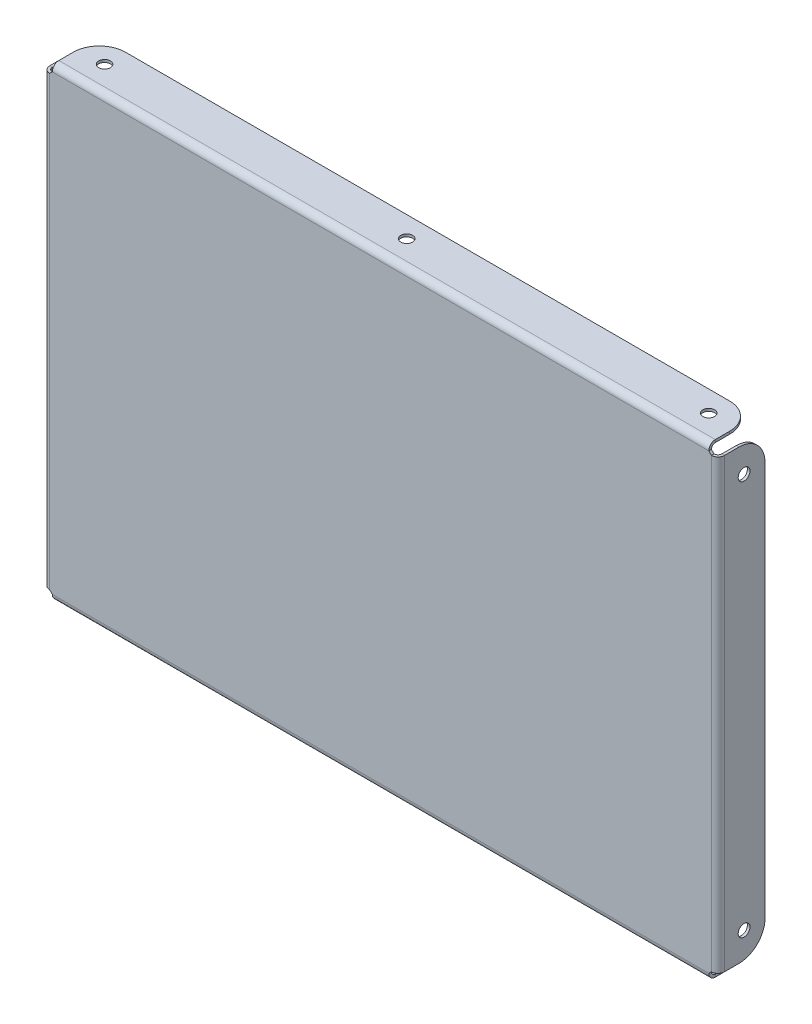
from build123d import *

# Parameters (mm, degrees)
MAIN_PLATE_DEPTH                         = 1
LONG_EDGE_DEPTH                          = 251
LONG_EDGE_FILLETS_R                      = 10
M4_CLEARANCE_HOLE1_D                     = 4.5
M4_CLEARANCE_HOLE1_DEPTH                 = 178
SHORT_EDGE_DEPTH                         = 171
SHORT_EDGE_FILLETS_R                     = 10
M4_CLEARANCE_HOLE2_D                     = 4.5
M4_CLEARANCE_HOLE2_DEPTH                 = 258
LONG_EDGE_FILLETS_OF_OTHER_LONG_EDGE_R   = 10
SHORT_EDGE_FILLETS_OF_OTHER_SHORT_EDGE_R = 10


# Sheet-metal steps are written as plain solids
with BuildPart() as part:
    # Sketch1 → Main Plate (new body)
    with BuildSketch(Plane.XY):
        Polygon((-126.5, -85.5), (-125.5, -86.5), (125.5, -86.5), (126.5, -85.5), (126.5, 85.5), (125.5, 86.5), (-125.5, 86.5), (-126.5, 85.5), align=None)
    extrude(amount=-MAIN_PLATE_DEPTH)

    # Long Edge section (across the edge) → Long Edge (add)
    with BuildSketch(Plane(origin=(-125.5, 88, -1), x_dir=(0, -1, 0), z_dir=(1, 0, 0))):
        with BuildLine():
            Line((-1, 1.5), (-1, 17))
            Line((-1, 17), (0, 17))
            Line((0, 17), (0, 1.5))
            ThreePointArc((0, 1.5), (0.439339828, 0.439339828), (1.5, 0))
            Line((1.5, 0), (1.5, -1))
            ThreePointArc((1.5, -1), (-0.267766953, -0.267766953), (-1, 1.5))
        make_face()
    long_edge = extrude(amount=LONG_EDGE_DEPTH)

    # Long Edge Fillets
    long_edge_fillets_edges = [part.edges().sort_by_distance(p)[0] for p in [
        (-125.5, 88.5, -18),
        (125.5, 88.5, -18),
    ]]
    fillet(long_edge_fillets_edges, radius=LONG_EDGE_FILLETS_R)

    # M4 Clearance Hole1
    with Locations(Plane(origin=(0, 89, 0), x_dir=(1, 0, 0), z_dir=(0, 1, 0))):
        with Locations((-115.5, 10), (115.5, 10), (0, 10)):
            m4_clearance_hole1 = Hole(M4_CLEARANCE_HOLE1_D / 2, depth=M4_CLEARANCE_HOLE1_DEPTH)

    # Short Edge section (across the edge) → Short Edge (add)
    with BuildSketch(Plane(origin=(128, 85.5, -1), x_dir=(-1, 0, 0), z_dir=(0, -1, 0))):
        with BuildLine():
            Line((-1, 1.5), (-1, 17))
            Line((-1, 17), (0, 17))
            Line((0, 17), (0, 1.5))
            ThreePointArc((0, 1.5), (0.439339828, 0.439339828), (1.5, 0))
            Line((1.5, 0), (1.5, -1))
            ThreePointArc((1.5, -1), (-0.267766953, -0.267766953), (-1, 1.5))
        make_face()
    short_edge = extrude(amount=SHORT_EDGE_DEPTH)

    # Short Edge Fillets
    short_edge_fillets_edges = [part.edges().sort_by_distance(p)[0] for p in [
        (128.5, 85.5, -18),
        (128.5, -85.5, -18),
    ]]
    fillet(short_edge_fillets_edges, radius=SHORT_EDGE_FILLETS_R)

    # M4 Clearance Hole2
    with Locations(Plane(origin=(129, 0, 0), x_dir=(0, 0, -1), z_dir=(1, 0, 0))):
        with Locations((10, -75.5), (10, 75.5)):
            m4_clearance_hole2 = Hole(M4_CLEARANCE_HOLE2_D / 2, depth=M4_CLEARANCE_HOLE2_DEPTH)

    # Other Long Edge: Long Edge, M4 Clearance Hole1 across plane
    add(long_edge.mirror(Plane.ZX))
    add(m4_clearance_hole1.mirror(Plane.ZX), mode=Mode.SUBTRACT)

    # Long Edge Fillets of Other Long Edge
    long_edge_fillets_of_other_long_edge_edges = [part.edges().sort_by_distance(p)[0] for p in [
        (-125.5, -88.5, -18),
        (125.5, -88.5, -18),
    ]]
    fillet(long_edge_fillets_of_other_long_edge_edges, radius=LONG_EDGE_FILLETS_OF_OTHER_LONG_EDGE_R)

    # Other Short Edge: Short Edge, M4 Clearance Hole2 across plane
    add(short_edge.mirror(Plane(origin=(0, 0, 0), x_dir=(0, 0, 1), z_dir=(1, 0, 0))))
    add(m4_clearance_hole2.mirror(Plane(origin=(0, 0, 0), x_dir=(0, 0, 1), z_dir=(1, 0, 0))), mode=Mode.SUBTRACT)

    # Short Edge Fillets of Other Short Edge
    short_edge_fillets_of_other_short_edge_edges = [part.edges().sort_by_distance(p)[0] for p in [
        (-128.5, 85.5, -18),
        (-128.5, -85.5, -18),
    ]]
    fillet(short_edge_fillets_of_other_short_edge_edges, radius=SHORT_EDGE_FILLETS_OF_OTHER_SHORT_EDGE_R)


solid = part.part
